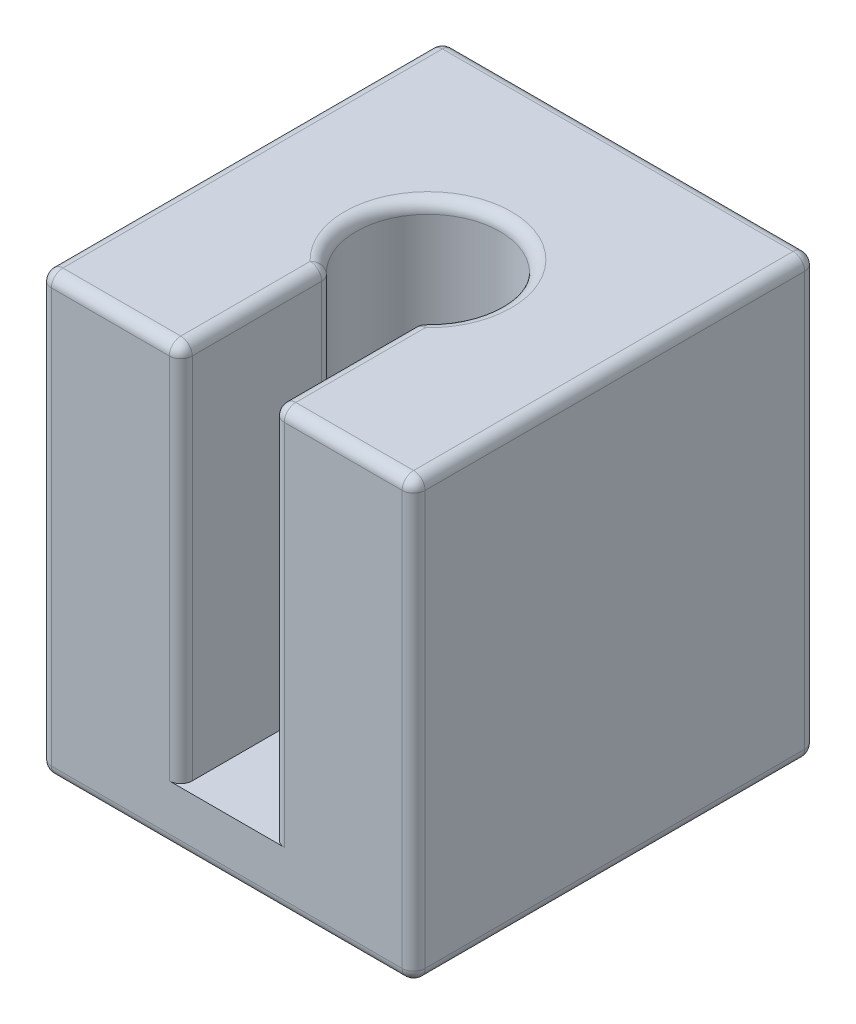
from build123d import *

# Parameters (mm, degrees)
SKETCH1_W           = 65
SKETCH1_H           = 70
BOSS_EXTRUDE1_DEPTH = 76
CUT_EXTRUDE1_DEPTH  = 66
FILLET1_R           = 2
FILLET2_R           = 2


with BuildPart() as part:
    # Sketch1 → Boss-Extrude1 (new body)
    with BuildSketch(Plane(origin=(0, 0, 0), x_dir=(1, 0, 0), z_dir=(0, 1, 0))):
        with Locations((32.5, 35)):
            Rectangle(SKETCH1_W, SKETCH1_H)
    extrude(amount=BOSS_EXTRUDE1_DEPTH)

    # Sketch2 → Cut-Extrude1 (cut)
    with BuildSketch(Plane(origin=(0, 76, 0), x_dir=(1, 0, 0), z_dir=(0, 1, 0))):
        with BuildLine():
            Line((24.5, 0), (24.5, 25.395313644))
            ThreePointArc((24.5, 25.395313644), (32.5, 47.5), (40.5, 25.395313644))
            Line((40.5, 25.395313644), (40.5, 0))
            Line((40.5, 0), (24.5, 0))
        make_face()
    extrude(amount=-CUT_EXTRUDE1_DEPTH, mode=Mode.SUBTRACT)

    # Fillet1
    fillet1_edges = [part.edges().sort_by_distance(p)[0] for p in [
        (65, 76, -35),
        (52.75, 76, 0),
        (32.5, 76, -70),
        (24.5, 43, -25.395313644),
        (40.5, 43, -25.395313644),
        (40.5, 43, 0),
        (24.5, 43, 0),
        (32.5, 76, -47.5),
        (24.5, 76, -12.697656822),
        (40.5, 76, -12.697656822),
        (0, 76, -35),
        (32.5, 0, -70),
        (32.5, 0, 0),
        (0, 0, -35),
        (0, 38, -70),
        (65, 38, -70),
        (65, 38, 0),
        (0, 38, 0),
        (12.25, 76, 0),
    ]]
    fillet(fillet1_edges, radius=FILLET1_R)

    # Fillet2
    # the kernel refuses this fillet: 2 mm, written as the material it takes off along each edge
    with BuildSketch(Plane(origin=(63, 2, -68), x_dir=(1, 0, 0), z_dir=(0, -1, 0))) as fillet2_piece_1_section:
        Polygon((0, 0), (FILLET2_R, 0), (FILLET2_R, -FILLET2_R), (0, -FILLET2_R), align=None)
    fillet2_piece_1 = extrude(amount=FILLET2_R, mode=Mode.PRIVATE)
    fillet2_piece_1 = fillet2_piece_1 - Plane(origin=(63, 2, -68), x_dir=(-0.7071067811865475, 0, 0.7071067811865475), z_dir=(0, -1, 0)) * Sphere(FILLET2_R, mode=Mode.PRIVATE)
    add(fillet2_piece_1, mode=Mode.SUBTRACT)
    with BuildSketch(Plane(origin=(63, 2, -2), x_dir=(1, 0, 0), z_dir=(0, -1, 0))) as fillet2_piece_2_section:
        Polygon((0, 0), (FILLET2_R, 0), (FILLET2_R, FILLET2_R), (0, FILLET2_R), align=None)
    fillet2_piece_2 = extrude(amount=FILLET2_R, mode=Mode.PRIVATE)
    fillet2_piece_2 = fillet2_piece_2 - Plane(origin=(63, 2, -2), x_dir=(-0.7071067811865475, 0, -0.7071067811865475), z_dir=(0, -1, 0)) * Sphere(FILLET2_R, mode=Mode.PRIVATE)
    add(fillet2_piece_2, mode=Mode.SUBTRACT)
    with BuildSketch(Plane(origin=(65, 0, -2), x_dir=(-1, 0, 0), z_dir=(0, 0, -1))) as fillet2_piece_3:
        with BuildLine():
            CenterArc((FILLET2_R, FILLET2_R), FILLET2_R, 180, 90)
            Line((0, FILLET2_R), (0, 0))
            Line((0, 0), (FILLET2_R, 0))
        make_face()
    extrude(amount=66, mode=Mode.SUBTRACT)


solid = part.part
